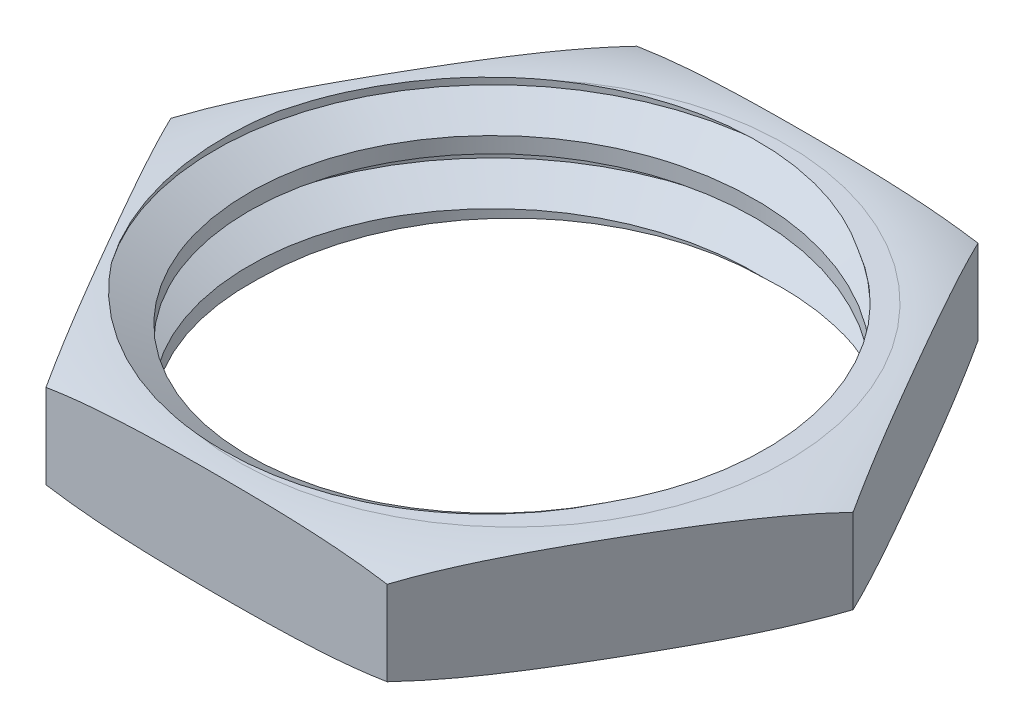
from build123d import *

# Parameters (mm, degrees)
CUT_EXTRUDE1_DEPTH      = 12.697127853
CUT_EXTRUDE1_DEPTH_BACK = 12.697127853
THREAD1_PITCH           = 1.5


with BuildPart() as part:
    # Sketch9 → Revolve1 (revolve)
    with BuildSketch(Plane.XY, mode=Mode.PRIVATE) as revolve1_sk:
        with BuildLine():
            Line((6, 2.5), (6, 0))
            Line((6, 0), (6.5, 0))
            ThreePointArc((6.5, 0), (7.299828107, 0.062886367), (8.08, 0.25))
            Line((8.08, 0.25), (8.08, 2.25))
            ThreePointArc((8.08, 2.25), (7.299828107, 2.437113633), (6.5, 2.5))
            Line((6.5, 2.5), (6, 2.5))
        make_face()
    revolve(revolve1_sk.sketch.rotate(Axis((0, 0, 0), (0, 1, 0)), 90), axis=Axis((0, 0, 0), (0, 1, 0)))

    # Sketch10 → Cut-Extrude1 (cut, two sides: drawn at the far end of the back side and taken through both)
    with BuildSketch(Plane(origin=(0, 2.5, 0), x_dir=(1, 0, 0), z_dir=(0, 1, 0)).offset(-CUT_EXTRUDE1_DEPTH_BACK)):
        with BuildLine():
            ThreePointArc((4.04, -6.997485263), (6.997485263, -4.04), (8.08, 0))
            Line((8.08, 0), (4.04, -6.997485263))
        make_face()
        with BuildLine():
            ThreePointArc((8.08, 0), (6.997485263, 4.04), (4.04, 6.997485263))
            Line((4.04, 6.997485263), (8.08, 0))
        make_face()
        with BuildLine():
            ThreePointArc((-4.04, -6.997485263), (0, -8.08), (4.04, -6.997485263))
            Line((4.04, -6.997485263), (-4.04, -6.997485263))
        make_face()
        with BuildLine():
            Line((-4.04, -6.997485263), (-8.08, 0))
            ThreePointArc((-8.08, 0), (-6.997485263, -4.04), (-4.04, -6.997485263))
        make_face()
        with BuildLine():
            Line((-8.08, 0), (-4.04, 6.997485263))
            ThreePointArc((-4.04, 6.997485263), (-6.997485263, 4.04), (-8.08, 0))
        make_face()
        with BuildLine():
            Line((-4.04, 6.997485263), (4.04, 6.997485263))
            ThreePointArc((4.04, 6.997485263), (0, 8.08), (-4.04, 6.997485263))
        make_face()
    extrude(amount=CUT_EXTRUDE1_DEPTH + CUT_EXTRUDE1_DEPTH_BACK, mode=Mode.SUBTRACT)

    # Thread1: the profile of Thread Profile1 profile screwed along a right-hand helix of 6.666667 turns, 8 arcs to a turn; built about Z, then put on its axis
    thread1_z = Axis((0, 0, 0), (0, 0, 1))
    thread1_corners = [(5.9997, 0, -0.000173205), (6.811898812, 0, 0.468749998), (6.811898812, 0, 0.656249998), (5.9997, 0, 1.125173201)]
    with BuildLine(mode=Mode.PRIVATE) as thread1_profile:
        Line(thread1_corners[0], thread1_corners[1])
        Line(thread1_corners[1], thread1_corners[2])
        Line(thread1_corners[2], thread1_corners[3])
        Line(thread1_corners[3], thread1_corners[0])
    thread1_cap = Face(thread1_profile.wire())
    thread1_turn_angles = [0, 22.5, 45, 67.5, 90, 112.5, 135, 157.5, 180, 202.5, 225, 247.5, 270, 292.5, 315, 337.5, 360]
    thread1_turn_weights = [1, 0.9238795325112867, 1, 0.9238795325112867, 1, 0.9238795325112867, 1, 0.9238795325112867, 1, 0.9238795325112867, 1, 0.9238795325112867, 1, 0.9238795325112867, 1, 0.9238795325112867, 1]
    thread1_turn_rails = [Edge.make_bspline([Vector(p[0], p[1], 0).rotate(thread1_z, thread1_turn_angles[k]) / thread1_turn_weights[k] + Vector(0, 0, p[2] + THREAD1_PITCH * thread1_turn_angles[k] / 360) for k in range(17)], [0, 0, 0, 1, 1, 2, 2, 3, 3, 4, 4, 5, 5, 6, 6, 7, 7, 8, 8, 8], 2, thread1_turn_weights) for p in thread1_corners]
    thread1_turn_sides = [Face.make_surface_from_curves(thread1_turn_rails[p[0]], thread1_turn_rails[p[1]]) for p in [(0, 1), (1, 2), (2, 3), (3, 0)]]
    thread1_last_angles = [2160, 2182.5, 2205, 2227.5, 2250, 2272.5, 2295, 2317.5, 2340, 2362.5, 2385, 2392.5, 2400]
    thread1_last_weights = [1, 0.9238795325112867, 1, 0.9238795325112867, 1, 0.9238795325112867, 1, 0.9238795325112867, 1, 0.9238795325112867, 1, 0.9914448613738109, 1]
    thread1_last_rails = [Edge.make_bspline([Vector(p[0], p[1], 0).rotate(thread1_z, thread1_last_angles[k]) / thread1_last_weights[k] + Vector(0, 0, p[2] + THREAD1_PITCH * thread1_last_angles[k] / 360) for k in range(13)], [0, 0, 0, 1, 1, 2, 2, 3, 3, 4, 4, 5, 5, 6, 6, 6], 2, thread1_last_weights) for p in thread1_corners]
    thread1_last_sides = [Face.make_surface_from_curves(thread1_last_rails[p[0]], thread1_last_rails[p[1]]) for p in [(0, 1), (1, 2), (2, 3), (3, 0)]]
    thread1 = Plane(origin=(0, 4.5, 0), x_dir=(-1, 0, 0), z_dir=(0, -1, 0)) * Solid(Shell([*[p.moved(Location((0, 0, THREAD1_PITCH * i))) for i in range(6) for p in thread1_turn_sides], *thread1_last_sides, thread1_cap, thread1_cap.rotate(thread1_z, 2400).moved(Location((0, 0, THREAD1_PITCH * 2400 / 360)))]))
    add(thread1, mode=Mode.SUBTRACT)


solid = part.part
